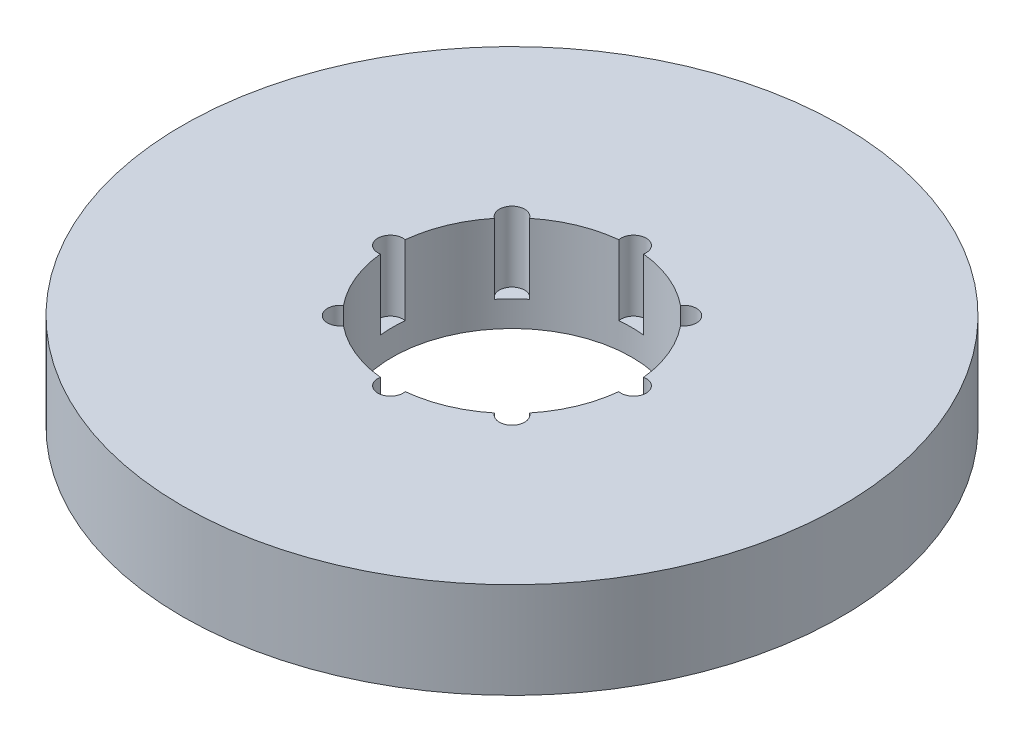
from build123d import *

# Parameters (mm, degrees)
SKETCH1_R           = 82.5
BOSS_EXTRUDE1_DEPTH = 24
SKETCH2_R           = 30
CUT_EXTRUDE1_DEPTH  = 120.115490177
SKETCH3_R           = 3.163918856
CUT_EXTRUDE2_DEPTH  = 17.562142321
CIRPATTERN1_COUNT   = 8


with BuildPart() as part:
    # Sketch1 → Boss-Extrude1 (new body)
    with BuildSketch(Plane(origin=(0, 0, 0), x_dir=(1, 0, 0), z_dir=(0, 1, 0))):
        Circle(SKETCH1_R)
    extrude(amount=BOSS_EXTRUDE1_DEPTH)

    # Sketch2 → Cut-Extrude1 (cut, through all)
    with BuildSketch(Plane(origin=(0, 0, 0), x_dir=(1, 0, 0), z_dir=(0, 1, 0))):
        Circle(SKETCH2_R)
    extrude(amount=CUT_EXTRUDE1_DEPTH, mode=Mode.SUBTRACT)

    # Sketch3 → Cut-Extrude2 (cut)
    with BuildSketch(Plane(origin=(0, 24, 0), x_dir=(1, 0, 0), z_dir=(0, 1, 0))):
        with Locations((-30.428694164, 0)):
            Circle(SKETCH3_R)
    cut_extrude2 = extrude(amount=-CUT_EXTRUDE2_DEPTH, mode=Mode.SUBTRACT)

    # CirPattern1: Cut-Extrude2 ×8 about axis
    cirpattern1_axis = Axis((0, 0, 0), (0, 1, 0))
    for i in range(1, CIRPATTERN1_COUNT):
        add(cut_extrude2.rotate(cirpattern1_axis, i * 360 / CIRPATTERN1_COUNT), mode=Mode.SUBTRACT)


solid = part.part
